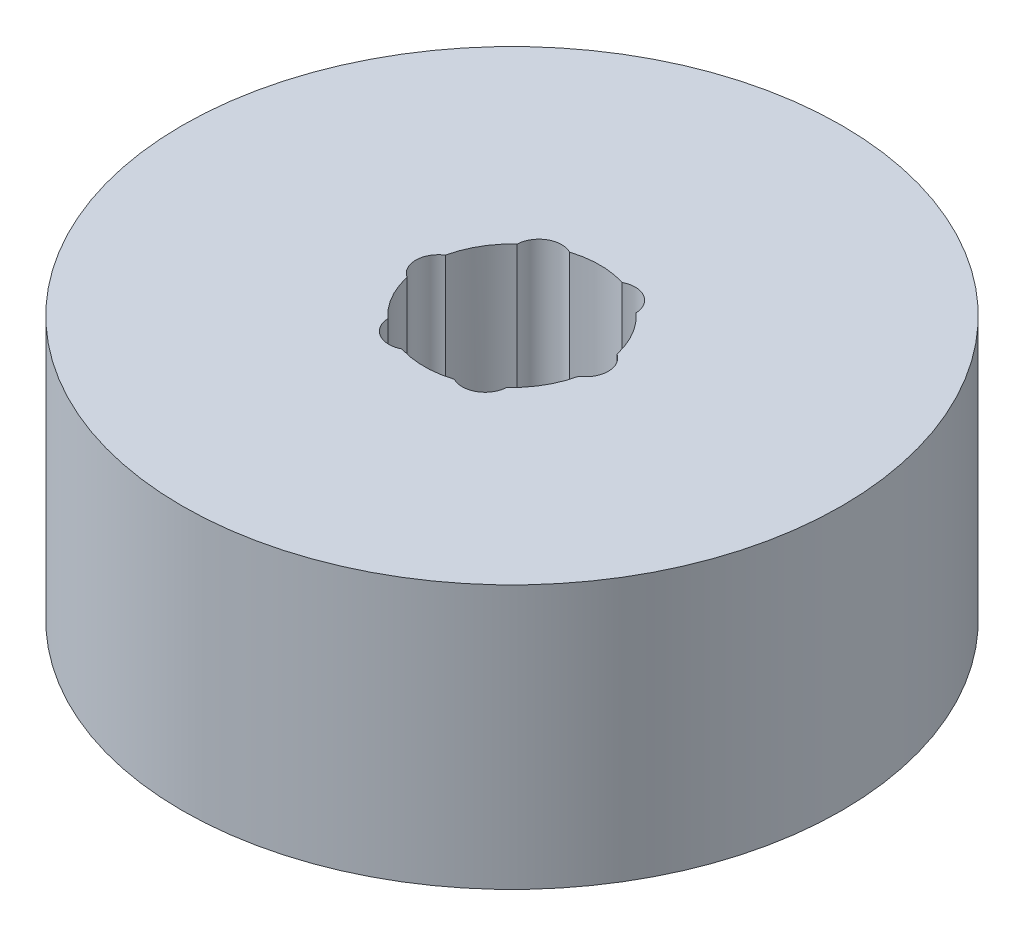
from build123d import *

# Parameters (mm, degrees)
SKETCH1_R           = 37.5
BOSS_EXTRUDE1_DEPTH = 30
SKETCH2_R           = 10
CUT_EXTRUDE1_DEPTH  = 61.930288035
SKETCH3_R           = 2.586960491
CUT_EXTRUDE2_DEPTH  = 20.8547146
CIRPATTERN1_COUNT   = 6


with BuildPart() as part:
    # Sketch1 → Boss-Extrude1 (new body)
    with BuildSketch(Plane(origin=(0, 0, 0), x_dir=(1, 0, 0), z_dir=(0, 1, 0))):
        Circle(SKETCH1_R)
    extrude(amount=BOSS_EXTRUDE1_DEPTH)

    # Sketch2 → Cut-Extrude1 (cut, through all)
    with BuildSketch(Plane(origin=(0, 0, 0), x_dir=(1, 0, 0), z_dir=(0, 1, 0))):
        Circle(SKETCH2_R)
    extrude(amount=CUT_EXTRUDE1_DEPTH, mode=Mode.SUBTRACT)

    # Sketch3 → Cut-Extrude2 (cut)
    with BuildSketch(Plane(origin=(0, 30, 0), x_dir=(1, 0, 0), z_dir=(0, 1, 0))):
        with Locations((-8.365906547, 0)):
            Circle(SKETCH3_R)
    cut_extrude2 = extrude(amount=-CUT_EXTRUDE2_DEPTH, mode=Mode.SUBTRACT)

    # CirPattern1: Cut-Extrude2 ×6 about axis
    cirpattern1_axis = Axis((0, 0, 0), (0, 1, 0))
    for i in range(1, CIRPATTERN1_COUNT):
        add(cut_extrude2.rotate(cirpattern1_axis, i * 360 / CIRPATTERN1_COUNT), mode=Mode.SUBTRACT)


solid = part.part
